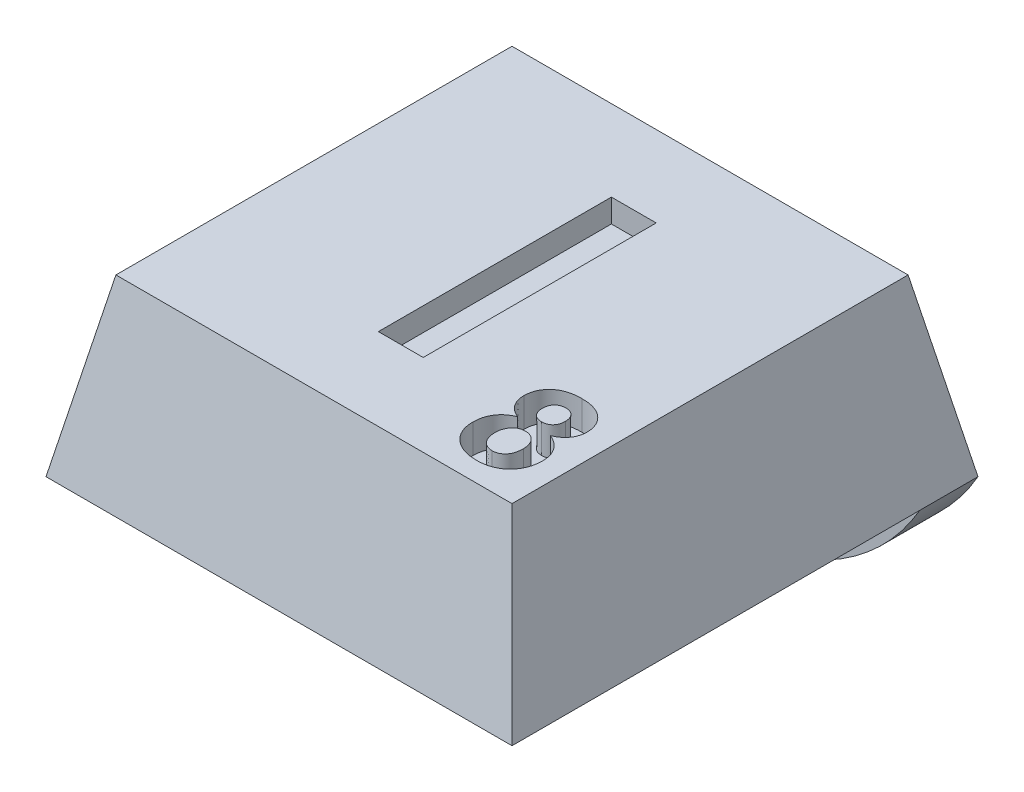
from build123d import *

# Parameters (mm, degrees)
SKETCH1_W               = 8
SKETCH1_H               = 8
BOSS_EXTRUDE1_DEPTH     = 3
CUT_EXTRUDE1_DEPTH      = 12.704699911
CUT_EXTRUDE1_DEPTH_BACK = 12.704699911
CUT_EXTRUDE2_DEPTH      = 11
SKETCH4_R               = 1.75
CUT_EXTRUDE3_DEPTH      = 0.4
SKETCH5_W               = 8
SKETCH5_H               = 1
BOSS_EXTRUDE2_DEPTH     = 2
FILLET1_R               = 4
SKETCH6_W               = 0.769230769
SKETCH6_H               = 4
CUT_EXTRUDE4_DEPTH      = 0.4
CUT_EXTRUDE5_DEPTH      = 0.5


with BuildPart() as part:
    # Sketch1 → Boss-Extrude1 (new body)
    with BuildSketch(Plane(origin=(0, 0, 0), x_dir=(1, 0, 0), z_dir=(0, 1, 0))):
        with Locations((4, 4)):
            Rectangle(SKETCH1_W, SKETCH1_H)
    extrude(amount=BOSS_EXTRUDE1_DEPTH)

    # Sketch2 → Cut-Extrude1 (cut, two sides: drawn at the far end of the back side and taken through both)
    with BuildSketch(Plane.XY.offset(-CUT_EXTRUDE1_DEPTH_BACK)):
        Polygon((0, 0), (0.6, 3), (0, 3), align=None)
        Polygon((8, 0), (7.4, 3), (8, 3), align=None)
    extrude(amount=CUT_EXTRUDE1_DEPTH + CUT_EXTRUDE1_DEPTH_BACK, mode=Mode.SUBTRACT)

    # Sketch3 → Cut-Extrude2 (cut)
    with BuildSketch(Plane(origin=(0, 0, 0), x_dir=(0, 0, -1), z_dir=(1, 0, 0))):
        Polygon((0, 0), (0.6, 3), (0, 3), align=None)
        Polygon((8, 3), (7.4, 3), (8, 0), align=None)
    extrude(amount=CUT_EXTRUDE2_DEPTH, mode=Mode.SUBTRACT)

    # Sketch4 → Cut-Extrude3 (cut)
    with BuildSketch(Plane.XZ):
        with Locations(Location((4, -3.75, 0), (0, 0, 270))):
            Circle(SKETCH4_R)
    extrude(amount=-CUT_EXTRUDE3_DEPTH, mode=Mode.SUBTRACT)

    # Sketch5 → Boss-Extrude2 (add)
    with BuildSketch(Plane.XZ):
        with Locations((4, -7.5)):
            Rectangle(SKETCH5_W, SKETCH5_H)
    extrude(amount=BOSS_EXTRUDE2_DEPTH)

    # Fillet1
    # the kernel refuses this fillet: 4 mm, written as the material it takes off along each edge
    with BuildSketch(Plane(origin=(8, -2, -16.660254038), x_dir=(0, 1, 0), z_dir=(0, 0, 1)), Plane(origin=(0, -2, 1.660254038), x_dir=(0, 1, 0), z_dir=(0, 0, -1))) as fillet1_piece_1:
        with BuildLine():
            CenterArc((4, 3.464101615), FILLET1_R, 180, 60)
            Line((0, 3.464101615), (-0.08, 3.464101615))
            Line((-0.08, 3.464101615), (-0.08, 0))
            Line((-0.08, 0), (0, -0.08))
            ThreePointArc((0, -0.08), (1, -0.08), (1.96, -0.069282032))
            Line((1.96, -0.069282032), (2, 0))
        make_face()
    extrude(amount=18.320508076, mode=Mode.SUBTRACT)

    # Sketch6 → Cut-Extrude4 (cut)
    with BuildSketch(Plane(origin=(0, 3, 0), x_dir=(1, 0, 0), z_dir=(0, 1, 0))):
        with Locations((4.080454652, 4.010567225)):
            Rectangle(SKETCH6_W, SKETCH6_H)
    extrude(amount=-CUT_EXTRUDE4_DEPTH, mode=Mode.SUBTRACT)

    # Sketch7 → Cut-Extrude5 (cut)
    with BuildSketch(Plane(origin=(0, 3, 0), x_dir=(1, 0, 0), z_dir=(0, 1, 0))):
        with BuildLine():
            add(Edge.make_bspline(
                [(6.15651658, 1.940494244), (6.145510655, 1.945154492), (6.123907371, 1.954301988), (6.09323484, 1.970294914), (6.064799566, 1.987351514), (6.03904827, 2.006151328), (6.014913928, 2.025334971), (5.993825771, 2.046858093), (5.974537605, 2.069089397), (5.952535222, 2.100444232), (5.930090229, 2.141832976), (5.910800925, 2.194430822), (5.898811147, 2.249451533), (5.897303934, 2.287068468), (5.896540619, 2.306119244)],
                knots=[0, 0, 0, 0, 0.898135024, 1.762928937, 2.598141881, 3.387992021, 4.158483993, 4.912374357, 5.649344587, 6.368826796, 7.78793972, 9.174346042, 10.568971657, 12, 12, 12, 12], degree=3))
            add(Edge.make_bspline(
                [(5.896540619, 2.306119244), (5.896949128, 2.322245314), (5.897751301, 2.353911386), (5.904281857, 2.400363734), (5.915616882, 2.44465812), (5.931010165, 2.486919818), (5.951038649, 2.526923073), (5.975496438, 2.56462901), (6.003930921, 2.600564872), (6.037294343, 2.633564085), (6.074323927, 2.664052327), (6.115534703, 2.69032529), (6.160485402, 2.712397947), (6.20891965, 2.730972479), (6.261326587, 2.744700346), (6.31723261, 2.754957515), (6.376837021, 2.760515608), (6.417804161, 2.761422579), (6.438848311, 2.761888475)],
                knots=[0, 0, 0, 0, 0.969401132, 1.903571386, 2.813295953, 3.714164367, 4.602979607, 5.497068024, 6.412430398, 7.352730811, 8.313282239, 9.291613189, 10.283859467, 11.320059661, 12.405231593, 13.536450991, 14.734515125, 16, 16, 16, 16], degree=3))
            add(Edge.make_bspline(
                [(6.438848311, 2.761888475), (6.459773562, 2.761431674), (6.500383715, 2.760545149), (6.55961144, 2.754877249), (6.615077261, 2.744816374), (6.667188187, 2.730854406), (6.715469625, 2.712293645), (6.760612767, 2.690551265), (6.801644432, 2.66381705), (6.838966437, 2.633598573), (6.872672652, 2.600569648), (6.901445211, 2.564628122), (6.926343213, 2.527027151), (6.946297666, 2.486906382), (6.961756812, 2.444666111), (6.972933798, 2.400328314), (6.980070192, 2.353946909), (6.98078976, 2.322251495), (6.981156004, 2.306119244)],
                knots=[0, 0, 0, 0, 1.259437241, 2.444221022, 3.576496957, 4.648717845, 5.68588583, 6.685544666, 7.658705287, 8.625770615, 9.572078176, 10.492824823, 11.391686538, 12.281331915, 13.183041723, 14.093615956, 15.029693465, 16, 16, 16, 16], degree=3))
            add(Edge.make_bspline(
                [(6.981156004, 2.306119244), (6.980366305, 2.286090338), (6.978812332, 2.246677396), (6.965258975, 2.189529308), (6.943928318, 2.135551364), (6.913295241, 2.085904697), (6.875370779, 2.040437046), (6.829547075, 2.001047886), (6.777330344, 1.966558185), (6.738534469, 1.949324529), (6.718656004, 1.940494244)],
                knots=[0, 0, 0, 0, 1.001685467, 1.971119642, 2.924446479, 3.896772127, 4.879289176, 5.877460772, 6.912440485, 8, 8, 8, 8], degree=3))
            add(Edge.make_bspline(
                [(6.718656004, 1.940494244), (6.730995791, 1.935383384), (6.755209584, 1.92535458), (6.789618906, 1.907504981), (6.821666519, 1.887953149), (6.85191654, 1.867223707), (6.879208616, 1.843911559), (6.904542812, 1.819378981), (6.927921941, 1.793284607), (6.948603911, 1.76528217), (6.967111811, 1.735846397), (6.983352513, 1.705442361), (6.996740217, 1.673626651), (7.007885734, 1.640992504), (7.016699849, 1.607138887), (7.022574215, 1.572136793), (7.026912363, 1.536034577), (7.0271763, 1.511541428), (7.02730985, 1.49914809)],
                knots=[0, 0, 0, 0, 1.114643742, 2.187213659, 3.231772812, 4.247796845, 5.244764516, 6.224002375, 7.19061506, 8.165938012, 9.126385546, 10.091434554, 11.040068535, 12.004700134, 12.968444139, 13.956586669, 14.966049226, 16, 16, 16, 16], degree=3))
            add(Edge.make_bspline(
                [(7.02730985, 1.49914809), (7.026796446, 1.478937492), (7.025787679, 1.439226454), (7.018711219, 1.38107925), (7.005929874, 1.325952641), (6.988491467, 1.273708162), (6.966746481, 1.223971877), (6.938910841, 1.177706145), (6.906713253, 1.134080082), (6.869643217, 1.093910629), (6.828597293, 1.057517999), (6.784112626, 1.025535606), (6.736110057, 0.99883009), (6.684984255, 0.976556488), (6.630355755, 0.95988295), (6.572607046, 0.947459175), (6.511624372, 0.940305747), (6.469876213, 0.939316226), (6.448583888, 0.938811552)],
                knots=[0, 0, 0, 0, 1.069671731, 2.10175744, 3.09402022, 4.059639235, 5.013663234, 5.960662081, 6.911094837, 7.879078902, 8.847982309, 9.810095429, 10.772776236, 11.750101161, 12.756155452, 13.790512928, 14.873121219, 16, 16, 16, 16], degree=3))
            add(Edge.make_bspline(
                [(6.448583888, 0.938811552), (6.428619193, 0.939272791), (6.389567235, 0.940174998), (6.332155248, 0.945908933), (6.277405474, 0.955949195), (6.225107083, 0.970165993), (6.175193963, 0.987917291), (6.128286945, 1.010684294), (6.083352924, 1.036376334), (6.055949035, 1.05713359), (6.042213696, 1.067537513)],
                knots=[0, 0, 0, 0, 1.102600357, 2.156742264, 3.182669202, 4.172953404, 5.147246686, 6.10327948, 7.049328352, 8, 8, 8, 8], degree=3))
            add(Edge.make_bspline(
                [(6.042213696, 1.067537513), (6.026828749, 1.080378521), (5.996458022, 1.105727373), (5.957746472, 1.14982945), (5.924287717, 1.196787263), (5.897240595, 1.247466884), (5.876140917, 1.301840234), (5.861164702, 1.359548786), (5.851827258, 1.420839433), (5.850875415, 1.46281546), (5.850386773, 1.484364436)],
                knots=[0, 0, 0, 0, 1.009349607, 1.992511403, 2.949479119, 3.912246635, 4.881480856, 5.884237694, 6.913844069, 8, 8, 8, 8], degree=3))
            add(Edge.make_bspline(
                [(5.850386773, 1.484364436), (5.851295235, 1.508227217), (5.853090808, 1.555391937), (5.867205324, 1.624626505), (5.890509398, 1.690664462), (5.91713497, 1.74293756), (5.943357572, 1.782163786), (5.96591762, 1.810161528), (5.991173615, 1.836408274), (6.018927817, 1.861025046), (6.049598606, 1.883490474), (6.082833606, 1.904254883), (6.118388609, 1.923985052), (6.143675127, 1.934933969), (6.15651658, 1.940494244)],
                knots=[0, 0, 0, 0, 1.466730477, 2.898988729, 4.325053486, 5.763136659, 6.492982434, 7.22372602, 7.971323195, 8.73066801, 9.502396106, 10.306304791, 11.139877329, 12, 12, 12, 12], degree=3))
        make_face()
        with BuildLine():
            add(Edge.make_bspline(
                [(6.242694465, 2.279075975), (6.243227056, 2.263511707), (6.244247122, 2.233701597), (6.254423757, 2.191695088), (6.271267591, 2.155002663), (6.294437582, 2.123896005), (6.323817487, 2.099406734), (6.357917342, 2.081867293), (6.396556715, 2.071574989), (6.423640052, 2.070264386), (6.43776658, 2.069580783)],
                knots=[0, 0, 0, 0, 1.15281608, 2.207978909, 3.181172827, 4.129718639, 5.059990565, 5.992992319, 6.953155196, 8, 8, 8, 8], degree=3))
            add(Edge.make_bspline(
                [(6.43776658, 2.069580783), (6.452019198, 2.070240913), (6.479498112, 2.071513639), (6.518435607, 2.08218095), (6.552976359, 2.099808827), (6.582400264, 2.12461233), (6.606163254, 2.155745627), (6.623191809, 2.192513664), (6.633513276, 2.234649719), (6.634488897, 2.264469788), (6.635002157, 2.280157706)],
                knots=[0, 0, 0, 0, 1.048069097, 2.020667378, 2.946900928, 3.882892544, 4.829907216, 5.807806237, 6.846717784, 8, 8, 8, 8], degree=3))
            add(Edge.make_bspline(
                [(6.635002157, 2.280157706), (6.634491926, 2.295013238), (6.633516102, 2.323424602), (6.622970742, 2.363619613), (6.606436408, 2.39945922), (6.582642474, 2.429691049), (6.554089388, 2.454874147), (6.520061906, 2.472182505), (6.481941896, 2.483104081), (6.455033522, 2.484327752), (6.441011773, 2.484965398)],
                knots=[0, 0, 0, 0, 1.120059371, 2.14212559, 3.117108277, 4.081714894, 5.028368956, 5.970787798, 6.942592912, 8, 8, 8, 8], degree=3))
            add(Edge.make_bspline(
                [(6.441011773, 2.484965398), (6.426516896, 2.484322219), (6.398793536, 2.483092056), (6.359460666, 2.472341434), (6.324738063, 2.454466675), (6.295507469, 2.429242148), (6.271712994, 2.39862944), (6.254554233, 2.362905047), (6.244256622, 2.322433946), (6.243229383, 2.293922732), (6.242694465, 2.279075975)],
                knots=[0, 0, 0, 0, 1.078082589, 2.061974896, 3.011033917, 3.963675658, 4.914590949, 5.879605178, 6.895838403, 8, 8, 8, 8], degree=3))
        make_face(mode=Mode.SUBTRACT)
        with BuildLine():
            add(Edge.make_bspline(
                [(6.196540619, 1.517176936), (6.196730477, 1.505629296), (6.197099128, 1.483207057), (6.20046304, 1.450559294), (6.205649554, 1.419730372), (6.21375861, 1.391003719), (6.223316031, 1.363907928), (6.235714339, 1.339167945), (6.249793304, 1.316020987), (6.266412851, 1.295211256), (6.28472227, 1.276705394), (6.303924475, 1.260084604), (6.324524838, 1.246535242), (6.346046028, 1.235062063), (6.368845981, 1.226421032), (6.392712607, 1.220489591), (6.41753513, 1.216100982), (6.434500999, 1.215858569), (6.443175234, 1.215734629)],
                knots=[0, 0, 0, 0, 1.266244622, 2.458687606, 3.596609786, 4.690452447, 5.728949622, 6.743059962, 7.719893583, 8.695837149, 9.65607124, 10.572687906, 11.475837526, 12.354503287, 13.243297811, 14.141816854, 15.049956288, 16, 16, 16, 16], degree=3))
            add(Edge.make_bspline(
                [(6.443175234, 1.215734629), (6.451602181, 1.215902824), (6.468057847, 1.216231266), (6.492249091, 1.219984617), (6.515274313, 1.226176747), (6.537422773, 1.234309167), (6.558086812, 1.245374324), (6.577789165, 1.258506963), (6.596578489, 1.273920235), (6.613783635, 1.292116571), (6.62981085, 1.312188806), (6.643411897, 1.33485558), (6.65555564, 1.35931889), (6.66456557, 1.386236104), (6.67253431, 1.414913473), (6.677108469, 1.44591441), (6.680631417, 1.478875262), (6.68097771, 1.501540921), (6.681156004, 1.51321059)],
                knots=[0, 0, 0, 0, 0.942317584, 1.840104704, 2.730710625, 3.607499931, 4.473808274, 5.346669015, 6.254175223, 7.186360584, 8.144194921, 9.122212144, 10.13877185, 11.193666142, 12.293061794, 13.46493029, 14.694790812, 16, 16, 16, 16], degree=3))
            add(Edge.make_bspline(
                [(6.681156004, 1.51321059), (6.680957439, 1.523435783), (6.680568608, 1.543458845), (6.677255041, 1.572763282), (6.671879045, 1.600628764), (6.664397898, 1.626985973), (6.654573048, 1.6515499), (6.642928518, 1.674710577), (6.628949814, 1.696276432), (6.612613113, 1.715977787), (6.595156277, 1.734014144), (6.576153606, 1.749704056), (6.556004184, 1.763065709), (6.534599532, 1.773990125), (6.512031704, 1.782228962), (6.488523892, 1.78844843), (6.463726194, 1.792153595), (6.446793708, 1.792487039), (6.438127157, 1.792657706)],
                knots=[0, 0, 0, 0, 1.18097333, 2.312592441, 3.401847494, 4.45657129, 5.472467779, 6.453609222, 7.447247299, 8.433973197, 9.406033457, 10.342947316, 11.274909381, 12.193955836, 13.112162788, 14.045055317, 14.999401151, 16, 16, 16, 16], degree=3))
            add(Edge.make_bspline(
                [(6.438127157, 1.792657706), (6.428259379, 1.792365239), (6.40916153, 1.791799208), (6.381426866, 1.787876586), (6.355713318, 1.780917675), (6.331705458, 1.771700183), (6.309770612, 1.759227348), (6.289908926, 1.74391846), (6.271697391, 1.726251639), (6.250860821, 1.699090969), (6.229093216, 1.662568124), (6.210711059, 1.615600245), (6.198388998, 1.567087579), (6.197157628, 1.533837656), (6.196540619, 1.517176936)],
                knots=[0, 0, 0, 0, 0.864439711, 1.673014741, 2.446909759, 3.19383146, 3.919980361, 4.648644137, 5.385779273, 6.135663785, 7.641703236, 9.092511638, 10.543128981, 12, 12, 12, 12], degree=3))
        make_face(mode=Mode.SUBTRACT)
    extrude(amount=-CUT_EXTRUDE5_DEPTH, mode=Mode.SUBTRACT)


solid = part.part
